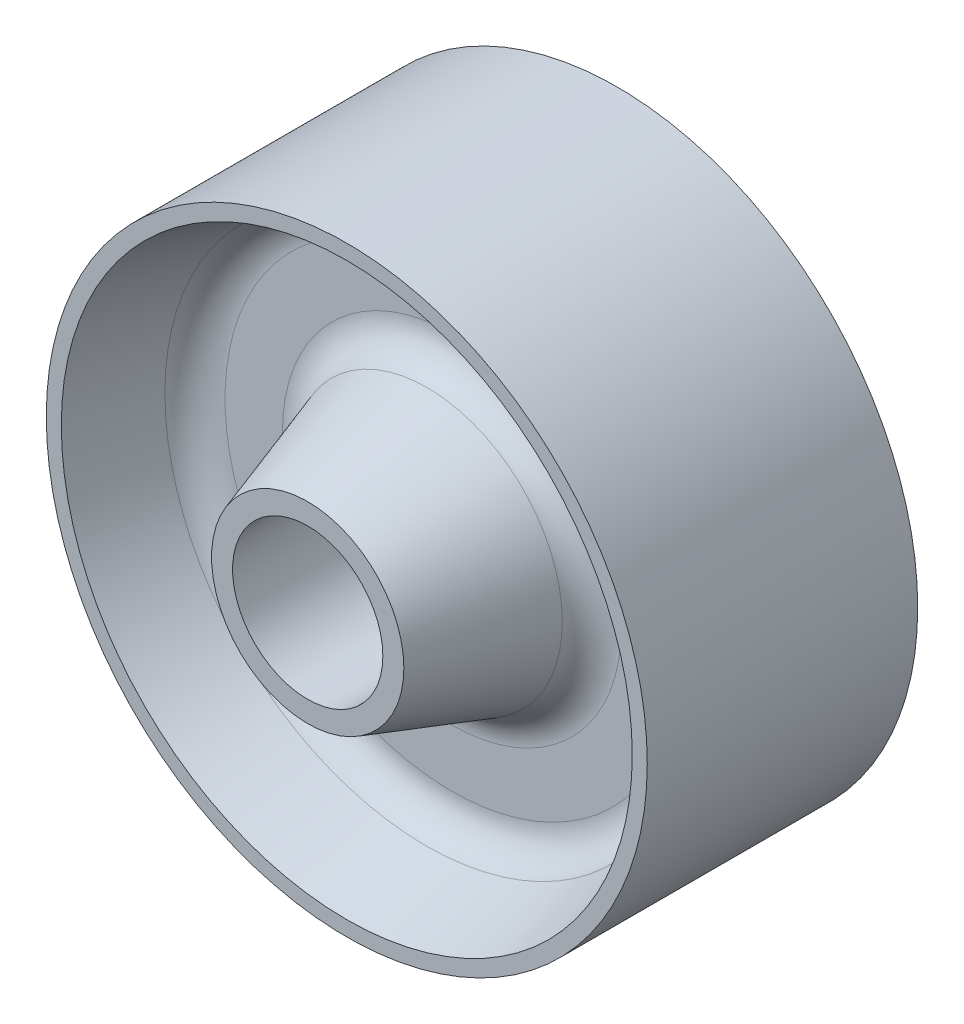
from build123d import *


with BuildPart() as part:
    # Sketch1 → Revolve1 (revolve)
    with BuildSketch(Plane(origin=(0, 0, 0), x_dir=(0, 0, -1), z_dir=(1, 0, 0))):
        with BuildLine():
            Line((-22.5, 50), (22.5, 50))
            Line((22.5, 50), (22.5, 47.5))
            Line((22.5, 47.5), (9.264260449, 43.5))
            ThreePointArc((9.264260449, 43.5), (6.182612881, 41.333250628), (5, 37.756550844))
            Line((5, 37.756550844), (5, 28.202513909))
            ThreePointArc((5, 28.202513909), (6.142274104, 24.680795703), (9.134166373, 22.5))
            Line((9.134166373, 22.5), (29, 16))
            Line((29, 16), (29, 12.5))
            Line((29, 12.5), (-29, 12.5))
            Line((-29, 12.5), (-29, 16))
            Line((-29, 16), (-9.134166373, 22.5))
            ThreePointArc((-9.134166373, 22.5), (-6.142274104, 24.680795703), (-5, 28.202513909))
            Line((-5, 28.202513909), (-5, 37.756550844))
            ThreePointArc((-5, 37.756550844), (-6.182612881, 41.333250628), (-9.264260449, 43.5))
            Line((-9.264260449, 43.5), (-22.5, 47.5))
            Line((-22.5, 47.5), (-22.5, 50))
        make_face()
    revolve(axis=Axis((0, 0, 41.444357118), (0, 0, -1)))


solid = part.part
